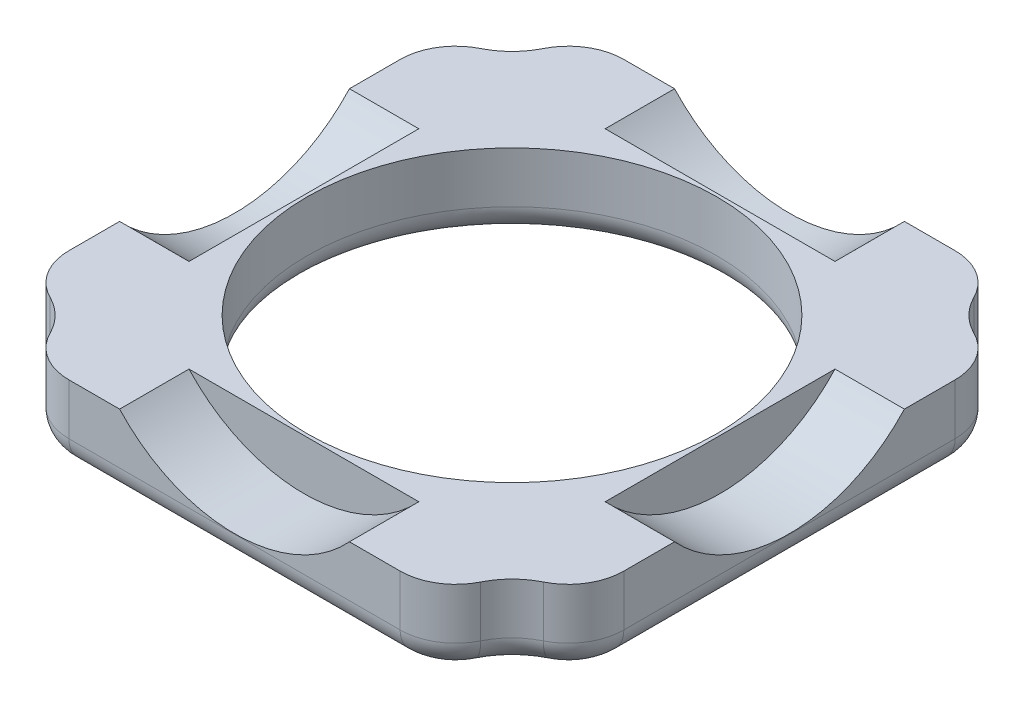
from build123d import *

# Parameters (mm, degrees)
SKETCH1_R           = 29.55371142
BOSS_EXTRUDE1_DEPTH = 11.355
CUT_EXTRUDE1_DEPTH  = 9.998813
CUT_EXTRUDE5_DEPTH  = 10
CUT_EXTRUDE6_DEPTH  = 9.999998
CUT_EXTRUDE7_DEPTH  = 10
FILLET1_R           = 4


# Read off the part's stored shape, not the designer's step: Surface-Imported1
with BuildPart() as part:
    # Sketch1 → Boss-Extrude1 (new body)
    with BuildSketch(Plane(origin=(0, 0, 0), x_dir=(1, 0, 0), z_dir=(0, 1, 0))):
        with BuildLine():
            Line((16.123584474, 0), (63.875229096, 0))
            ThreePointArc((63.875229096, 0), (68.091521161, -1.20125885), (71.041598686, -4.444279694))
            ThreePointArc((71.041598686, -4.444279694), (72.928335493, -7.070478077), (75.554533876, -8.957214884))
            ThreePointArc((75.554533876, -8.957214884), (78.79755472, -11.907292409), (79.99881357, -16.123584474))
            Line((79.99881357, -16.123584474), (79.99881357, -63.876413738))
            ThreePointArc((79.99881357, -63.876413738), (78.79755472, -68.092705803), (75.554533876, -71.042783328))
            ThreePointArc((75.554533876, -71.042783328), (72.928335493, -72.929520135), (71.041598686, -75.555718518))
            ThreePointArc((71.041598686, -75.555718518), (68.091521161, -78.798739362), (63.875229096, -79.999998212))
            Line((63.875229096, -79.999998212), (16.123584474, -79.999998212))
            ThreePointArc((16.123584474, -79.999998212), (11.907292409, -78.798739362), (8.957214884, -75.555718518))
            ThreePointArc((8.957214884, -75.555718518), (7.070478077, -72.929520135), (4.444279694, -71.042783328))
            ThreePointArc((4.444279694, -71.042783328), (1.20125885, -68.092705803), (0, -63.876413738))
            Line((0, -63.876413738), (0, -16.123584474))
            ThreePointArc((0, -16.123584474), (1.20125885, -11.907292409), (4.444279694, -8.957214884))
            ThreePointArc((4.444279694, -8.957214884), (7.070478077, -7.070478077), (8.957214884, -4.444279694))
            ThreePointArc((8.957214884, -4.444279694), (11.907292409, -1.20125885), (16.123584474, 0))
        make_face()
        with Locations(Location((39.999406785, -39.999999106, 0), (0, 0, 270))):
            Circle(SKETCH1_R, mode=Mode.SUBTRACT)
    extrude(amount=BOSS_EXTRUDE1_DEPTH)

    # Sketch2 → Cut-Extrude1 (cut)
    with BuildSketch(Plane(origin=(79.99881357, 0, 0), x_dir=(0, 0, -1), z_dir=(1, 0, 0))):
        with BuildLine():
            Line((-56.770510972, 11.581630446), (-23.229489103, 11.581630446))
            ThreePointArc((-23.229489103, 11.581630446), (-40.000000037, 4.081632348), (-56.770510972, 11.581630446))
        make_face()
    extrude(amount=-CUT_EXTRUDE1_DEPTH, mode=Mode.SUBTRACT)

    # Sketch3 → Cut-Extrude5 (cut)
    with BuildSketch(Plane.ZY):
        with BuildLine():
            Line((23.229489103, 11.581630446), (56.770510972, 11.581630446))
            ThreePointArc((56.770510972, 11.581630446), (40.000000037, 4.081630803), (23.229489103, 11.581630446))
        make_face()
    extrude(amount=-CUT_EXTRUDE5_DEPTH, mode=Mode.SUBTRACT)

    # Sketch4 → Cut-Extrude6 (cut)
    with BuildSketch(Plane.XY.offset(79.999998212)):
        with BuildLine():
            Line((23.229489103, 11.581630446), (56.770510972, 11.581630446))
            ThreePointArc((56.770510972, 11.581630446), (40.000000037, 4.081632696), (23.229489103, 11.581630446))
        make_face()
    extrude(amount=-CUT_EXTRUDE6_DEPTH, mode=Mode.SUBTRACT)

    # Sketch5 → Cut-Extrude7 (cut)
    with BuildSketch(Plane(origin=(0, 0, 0), x_dir=(-1, 0, 0), z_dir=(0, 0, -1))):
        with BuildLine():
            Line((-56.770510972, 11.581630446), (-23.229489103, 11.581630446))
            ThreePointArc((-23.229489103, 11.581630446), (-40.000000037, 4.081631894), (-56.770510972, 11.581630446))
        make_face()
    extrude(amount=-CUT_EXTRUDE7_DEPTH, mode=Mode.SUBTRACT)

    # Fillet1
    fillet1_edges = [part.edges().sort_by_distance(p)[0] for p in [
        (7.070478077, 0, 7.070478077),
        (11.907292409, 0, 1.20125885),
        (39.999406785, 0, 0),
        (68.091521161, 0, 1.20125885),
        (72.928335493, 0, 7.070478077),
        (78.79755472, 0, 11.907292409),
        (79.99881357, 0, 39.999999106),
        (78.79755472, 0, 68.092705803),
        (72.928335493, 0, 72.929520135),
        (68.091521161, 0, 78.798739362),
        (39.999406785, 0, 79.999998212),
        (11.907292409, 0, 78.798739362),
        (7.070478077, 0, 72.929520135),
        (1.20125885, 0, 68.092705803),
        (0, 0, 39.999999106),
        (1.20125885, 0, 11.907292409),
        (39.999406785, 0, 10.446287686),
    ]]
    fillet(fillet1_edges, radius=FILLET1_R)


solid = part.part
